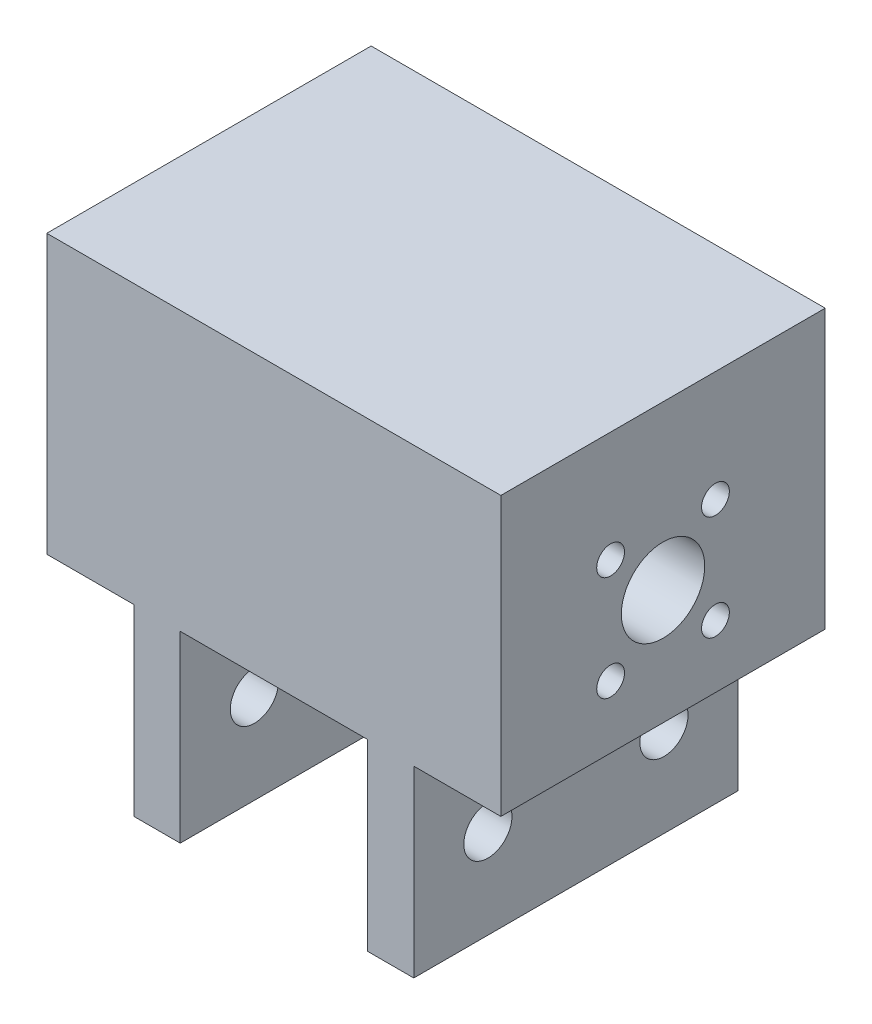
from build123d import *

# Parameters (mm, degrees)
EXTRUDE_1_DEPTH     = 35
HOLE_WIZARD_1_D     = 9
SKETCH_12_R         = 1.5
CUT_EXTRUDE_1_DEPTH = 70.548831766
SKETCH_15_R         = 5.2
CUT_EXTRUDE_4_DEPTH = 16
SKETCH_14_R         = 11.75
CUT_EXTRUDE_3_DEPTH = 4
HOLE_WIZARD_2_D     = 5.2
HOLE_WIZARD_2_DEPTH = 100


with BuildPart() as part:
    # 草图1 → 凸台-拉伸1 (new body)
    with BuildSketch(Plane.XY):
        Polygon((10.1, -15), (10.1, -34.8), (15.1, -34.8), (15.1, -15), (24.5, -15), (24.5, 15), (-24.5, 15), (-24.5, -15), (-15.1, -15), (-15.1, -34.8), (-10.1, -34.8), (-10.1, -15), align=None)
    extrude(amount=EXTRUDE_1_DEPTH)

    # 孔1 (through all)
    with Locations(Plane.ZY.offset(24.5)):
        with Locations((17.5, -2.6)):
            Hole(HOLE_WIZARD_1_D / 2)

    # 草图12 → 切除-拉伸1 (cut, through all)
    with BuildSketch(Plane.ZY.offset(24.5)):
        with Locations((11.843145751, 3.056854249)):
            Circle(SKETCH_12_R)
        with Locations((23.156854249, 3.056854249)):
            Circle(SKETCH_12_R)
        with Locations((23.156854249, -8.256854249)):
            Circle(SKETCH_12_R)
        with Locations((11.843145751, -8.256854249)):
            Circle(SKETCH_12_R)
    extrude(amount=-CUT_EXTRUDE_1_DEPTH, mode=Mode.SUBTRACT)

    # 草图15 → 切除-拉伸4 (cut)
    with BuildSketch(Plane.ZY.offset(24.5)):
        with Locations((17.5, -2.6)):
            Circle(SKETCH_15_R)
    extrude(amount=-CUT_EXTRUDE_4_DEPTH, mode=Mode.SUBTRACT)

    # 草图14 → 切除-拉伸3 (cut)
    with BuildSketch(Plane.ZY.offset(24.5)):
        with Locations((17.5, -2.6)):
            Circle(SKETCH_14_R)
    extrude(amount=-CUT_EXTRUDE_3_DEPTH, mode=Mode.SUBTRACT)

    # 孔2
    with Locations(Plane.ZY.offset(15.1)):
        with Locations((8, -25), (27, -25)):
            Hole(HOLE_WIZARD_2_D / 2, depth=HOLE_WIZARD_2_DEPTH)


solid = part.part
